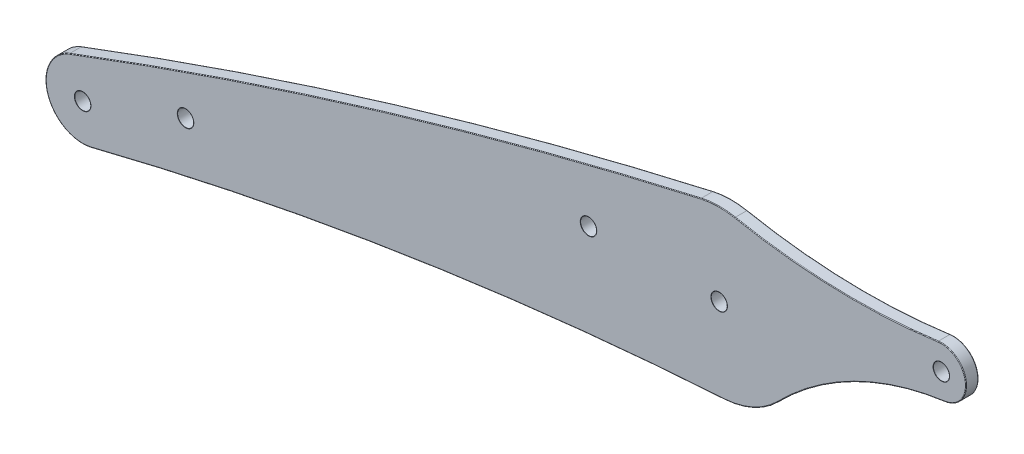
from build123d import *

# Parameters (mm, degrees)
BOSS_EXTRUDE1_DEPTH              = 3
M3_5_CLEARANCE_HOLE1_D           = 3.9
M3_5_CLEARANCE_HOLE1_DEPTH       = 10
M3_5_CLEARANCE_HOLE1_CSINK_D     = 3.95
M3_5_CLEARANCE_HOLE1_CSINK_ANGLE = 90
M3_5_CLEARANCE_HOLE1_TIP         = 1.171678207
FILLET1_R                        = 0.15


with BuildPart() as part:
    # Sketch1 → Boss-Extrude1 (new body)
    with BuildSketch(Plane.XY):
        with BuildLine():
            ThreePointArc((-224.015272003, 171.533169094), (-148.098758742, 197.332237707), (-70.569094062, 217.778753835))
            ThreePointArc((-70.569094062, 217.778753835), (-66.438171207, 218.27179356), (-62.294616847, 217.899544886))
            ThreePointArc((-62.294616847, 217.899544886), (-37.687608562, 215.152778571), (-12.963979761, 216.491345274))
            ThreePointArc((-12.963979761, 216.491345274), (-6.2015881, 211.360407363), (-11.337827727, 204.602041635))
            ThreePointArc((-11.337827727, 204.602041635), (-33.296637982, 197.807484116), (-51.870705986, 184.266459136))
            ThreePointArc((-51.870705986, 184.266459136), (-57.830628756, 180.084625725), (-64.892545086, 178.313256803))
            ThreePointArc((-64.892545086, 178.313256803), (-142.310888673, 169.876188253), (-218.632111132, 154.388933759))
            ThreePointArc((-218.632111132, 154.388933759), (-229.410768693, 160.421770071), (-224.015272003, 171.533169094))
        make_face()
    extrude(amount=-BOSS_EXTRUDE1_DEPTH)

    # M3.5 Clearance Hole1
    with Locations(Plane.XY):
        with Locations((-220.824105329, 163.117917746), (-195.824105329, 172.033120757), (-97.896241747, 198.246037312), (-66.146241747, 198.273924243), (-12.146241747, 210.547331096)):
            CounterSinkHole(M3_5_CLEARANCE_HOLE1_D / 2, M3_5_CLEARANCE_HOLE1_CSINK_D / 2, depth=M3_5_CLEARANCE_HOLE1_DEPTH, counter_sink_angle=M3_5_CLEARANCE_HOLE1_CSINK_ANGLE)
            with Locations((0, 0, -(M3_5_CLEARANCE_HOLE1_DEPTH + M3_5_CLEARANCE_HOLE1_TIP / 2))):  # 118° drill point
                Cone(0, M3_5_CLEARANCE_HOLE1_D / 2, M3_5_CLEARANCE_HOLE1_TIP, mode=Mode.SUBTRACT)

    # Fillet1
    # the kernel refuses this fillet: 0.15 mm, written as the material it takes off along each edge
    with BuildSketch(Plane(origin=(-1.906330822, 135.24033126, 0), x_dir=(-0.1347356700689116, 0.9908815767845728, 0), z_dir=(0.9908815767845728, 0.1347356700689116, 0))) as fillet1_piece_1:
        with BuildLine():
            CenterArc((70 + FILLET1_R, -FILLET1_R), FILLET1_R, 90, 90)
            Line((70 + FILLET1_R, 0), (70 + FILLET1_R, FILLET1_R * 0.02))
            Line((70 + FILLET1_R, FILLET1_R * 0.02), (70 - FILLET1_R * 0.0200000000001, FILLET1_R * 0.02))
            Line((70 - FILLET1_R * 0.0200000000001, FILLET1_R * 0.02), (70 - FILLET1_R * 0.0200000000001, -FILLET1_R))
            Line((70 - FILLET1_R * 0.0200000000001, -FILLET1_R), (70, -FILLET1_R))
        make_face()
    revolve(axis=Axis((-1.906330822, 135.24033126, 0), (0, 0, 1)), revolution_arc=37.799706741, mode=Mode.SUBTRACT)
    with BuildSketch(Plane(origin=(-66.146241747, 198.273924243, 0), x_dir=(0.7137767880581837, -0.7003732553641258, 0), z_dir=(0.7003732553641258, 0.7137767880581837, 0))) as fillet1_piece_2:
        with BuildLine():
            CenterArc((20 - FILLET1_R, FILLET1_R), FILLET1_R, 270, 90)
            Line((20 - FILLET1_R, 0), (20 - FILLET1_R, -FILLET1_R * 0.02))
            Line((20 - FILLET1_R, -FILLET1_R * 0.02), (20 + FILLET1_R * 0.02, -FILLET1_R * 0.02))
            Line((20 + FILLET1_R * 0.02, -FILLET1_R * 0.02), (20 + FILLET1_R * 0.0199999999999, FILLET1_R))
            Line((20 + FILLET1_R * 0.0199999999999, FILLET1_R), (20, FILLET1_R))
        make_face()
    revolve(axis=Axis((-66.146241747, 198.273924243, 0), (0, 0, -1)), revolution_arc=41.949109333, mode=Mode.SUBTRACT)
    with BuildSketch(Plane(origin=(-11.610436968, -670.01510943, 0), x_dir=(-0.0626848330802095, 0.9980333720380827, 0), z_dir=(0.9980333720380827, 0.0626848330802095, 0))) as fillet1_piece_3:
        with BuildLine():
            CenterArc((850 + FILLET1_R, -FILLET1_R), FILLET1_R, 90, 90)
            Line((850, -FILLET1_R), (850 - FILLET1_R * 0.0200000000003, -FILLET1_R))
            Line((850 - FILLET1_R * 0.0200000000003, -FILLET1_R), (850 - FILLET1_R * 0.0200000000003, FILLET1_R * 0.02))
            Line((850 - FILLET1_R * 0.0200000000003, FILLET1_R * 0.02), (850 + FILLET1_R, FILLET1_R * 0.02))
            Line((850 + FILLET1_R, FILLET1_R * 0.02), (850 + FILLET1_R, 0))
        make_face()
    revolve(axis=Axis((-11.610436968, -670.01510943, 0), (0, 0, 1)), revolution_arc=10.502516864, mode=Mode.SUBTRACT)
    with BuildSketch(Plane(origin=(-220.824105329, 163.117917746, 0), x_dir=(0.24355491078225822, -0.9698871096338203, 0), z_dir=(0.9698871096338203, 0.24355491078225822, 0))) as fillet1_piece_4:
        with BuildLine():
            CenterArc((9 - FILLET1_R, FILLET1_R), FILLET1_R, 270, 90)
            Line((9 - FILLET1_R, 0), (9 - FILLET1_R, -FILLET1_R * 0.02))
            Line((9 - FILLET1_R, -FILLET1_R * 0.02), (9 + FILLET1_R * 0.0200000000001, -FILLET1_R * 0.02))
            Line((9 + FILLET1_R * 0.0200000000001, -FILLET1_R * 0.02), (9 + FILLET1_R * 0.0200000000001, FILLET1_R))
            Line((9 + FILLET1_R * 0.0200000000001, FILLET1_R), (9, FILLET1_R))
        make_face()
    revolve(axis=Axis((-220.824105329, 163.117917746, 0), (0, 0, -1)), revolution_arc=173.329106849, mode=Mode.SUBTRACT)
    with BuildSketch(Plane(origin=(-66.146241747, 198.273924243, -3), x_dir=(0.7137767880581837, -0.7003732553641258, 0), z_dir=(0.7003732553641258, 0.7137767880581837, 0))) as fillet1_piece_5:
        with BuildLine():
            CenterArc((20 - FILLET1_R, -FILLET1_R), FILLET1_R, 0, 90)
            Line((20, -FILLET1_R), (20 + FILLET1_R * 0.0199999999999, -FILLET1_R))
            Line((20 + FILLET1_R * 0.0199999999999, -FILLET1_R), (20 + FILLET1_R * 0.02, FILLET1_R * 0.02))
            Line((20 + FILLET1_R * 0.02, FILLET1_R * 0.02), (20 - FILLET1_R, FILLET1_R * 0.02))
            Line((20 - FILLET1_R, FILLET1_R * 0.02), (20 - FILLET1_R, 0))
        make_face()
    revolve(axis=Axis((-66.146241747, 198.273924243, -3), (0, 0, -1)), revolution_arc=41.949109333, mode=Mode.SUBTRACT)
    with BuildSketch(Plane(origin=(-1.906330822, 135.24033126, -3), x_dir=(-0.1347356700689116, 0.9908815767845728, 0), z_dir=(0.9908815767845728, 0.1347356700689116, 0))) as fillet1_piece_6:
        with BuildLine():
            CenterArc((70 + FILLET1_R, FILLET1_R), FILLET1_R, 180, 90)
            Line((70, FILLET1_R), (70 - FILLET1_R * 0.0200000000001, FILLET1_R))
            Line((70 - FILLET1_R * 0.0200000000001, FILLET1_R), (70 - FILLET1_R * 0.0200000000001, -FILLET1_R * 0.02))
            Line((70 - FILLET1_R * 0.0200000000001, -FILLET1_R * 0.02), (70 + FILLET1_R, -FILLET1_R * 0.02))
            Line((70 + FILLET1_R, -FILLET1_R * 0.02), (70 + FILLET1_R, 0))
        make_face()
    revolve(axis=Axis((-1.906330822, 135.24033126, -3), (0, 0, 1)), revolution_arc=37.799706741, mode=Mode.SUBTRACT)
    with BuildSketch(Plane(origin=(-12.146241747, 210.547331096, -3), x_dir=(-0.1362896688862403, 0.9906690295728836, 0), z_dir=(-0.9906690295728836, -0.1362896688862403, 0))) as fillet1_piece_7:
        with BuildLine():
            CenterArc((6 - FILLET1_R, -FILLET1_R), FILLET1_R, 0, 90)
            Line((6, -FILLET1_R), (6 + FILLET1_R * 0.02, -FILLET1_R))
            Line((6 + FILLET1_R * 0.02, -FILLET1_R), (6 + FILLET1_R * 0.02, FILLET1_R * 0.02))
            Line((6 + FILLET1_R * 0.02, FILLET1_R * 0.02), (6 - FILLET1_R, FILLET1_R * 0.02))
            Line((6 - FILLET1_R, FILLET1_R * 0.02), (6 - FILLET1_R, 0))
        make_face()
    revolve(axis=Axis((-12.146241747, 210.547331096, -3), (0, 0, -1)), revolution_arc=180.089866547, mode=Mode.SUBTRACT)
    with BuildSketch(Plane(origin=(-33.407430094, 365.091699709, -3), x_dir=(-0.19258124502204366, -0.9812810321542751, 0), z_dir=(-0.9812810321542751, 0.19258124502204366, 0))) as fillet1_piece_8:
        with BuildLine():
            CenterArc((150 + FILLET1_R, FILLET1_R), FILLET1_R, 180, 90)
            Line((150, FILLET1_R), (150 - FILLET1_R * 0.0199999999999, FILLET1_R))
            Line((150 - FILLET1_R * 0.0199999999999, FILLET1_R), (150 - FILLET1_R * 0.0199999999999, -FILLET1_R * 0.02))
            Line((150 - FILLET1_R * 0.0199999999999, -FILLET1_R * 0.02), (150 + FILLET1_R, -FILLET1_R * 0.02))
            Line((150 + FILLET1_R, -FILLET1_R * 0.02), (150 + FILLET1_R, 0))
        make_face()
    revolve(axis=Axis((-33.407430094, 365.091699709, -3), (0, 0, 1)), revolution_arc=18.936662977, mode=Mode.SUBTRACT)
    with BuildSketch(Plane(origin=(-66.146241747, 198.273924243, -3), x_dir=(-0.22114261575913643, 0.9752414795809328, 0), z_dir=(-0.9752414795809328, -0.22114261575913643, 0))) as fillet1_piece_9:
        with BuildLine():
            CenterArc((20 - FILLET1_R, -FILLET1_R), FILLET1_R, 0, 90)
            Line((20, -FILLET1_R), (20 + FILLET1_R * 0.02, -FILLET1_R))
            Line((20 + FILLET1_R * 0.02, -FILLET1_R), (20 + FILLET1_R * 0.02, FILLET1_R * 0.02))
            Line((20 + FILLET1_R * 0.02, FILLET1_R * 0.02), (20 - FILLET1_R, FILLET1_R * 0.02))
            Line((20 - FILLET1_R, FILLET1_R * 0.02), (20 - FILLET1_R, 0))
        make_face()
    revolve(axis=Axis((-66.146241747, 198.273924243, -3), (0, 0, -1)), revolution_arc=23.879614349, mode=Mode.SUBTRACT)
    with BuildSketch(Plane(origin=(-12.146241747, 210.547331096, -3), x_dir=(-1, 0, 0), z_dir=(0, -1, 0))) as fillet1_piece_10:
        with BuildLine():
            CenterArc((1.95 + FILLET1_R, -FILLET1_R), FILLET1_R, 90, 90)
            Line((1.95, -FILLET1_R), (1.95 - FILLET1_R * 0.02, -FILLET1_R))
            Line((1.95 - FILLET1_R * 0.02, -FILLET1_R), (1.95 - FILLET1_R * 0.02, FILLET1_R * 0.02))
            Line((1.95 - FILLET1_R * 0.02, FILLET1_R * 0.02), (1.95 + FILLET1_R, FILLET1_R * 0.02))
            Line((1.95 + FILLET1_R, FILLET1_R * 0.02), (1.95 + FILLET1_R, 0))
        make_face()
    revolve(axis=Axis((-12.146241747, 210.547331096, -3), (0, 0, -1)), mode=Mode.SUBTRACT)
    with BuildSketch(Plane(origin=(-12.146241747, 210.547331096, 0), x_dir=(-1, 0, 0), z_dir=(0, -1, 0))) as fillet1_piece_11:
        with BuildLine():
            CenterArc((2.03291562, 0.15), FILLET1_R, 236.442690238, 33.557309762)
            Line((2.03291562, 0), (2.03291562, -0.003))
            Line((2.03291562, -0.003), (1.975, -0.003))
            Line((1.975, -0.003), (1.97287868, -0.00212132))
            ThreePointArc((1.97287868, -0.00212132), (1.96037868, 0.01037868), (1.948341688, 0.0225))
            Line((1.948341688, 0.0225), (1.95, 0.025))
        make_face()
    revolve(axis=Axis((-12.146241747, 210.547331096, 0), (0, 0, -1)), mode=Mode.SUBTRACT)
    with BuildSketch(Plane(origin=(183.744914061, -903.748947683, -3), x_dir=(-0.3545740748378603, 0.935027927632579, 0), z_dir=(-0.935027927632579, -0.3545740748378603, 0))) as fillet1_piece_12:
        with BuildLine():
            CenterArc((1150 - FILLET1_R, -FILLET1_R), FILLET1_R, 0, 90)
            Line((1150, -FILLET1_R), (1150 + FILLET1_R * 0.020000000001, -FILLET1_R))
            Line((1150 + FILLET1_R * 0.020000000001, -FILLET1_R), (1150 + FILLET1_R * 0.020000000001, FILLET1_R * 0.02))
            Line((1150 + FILLET1_R * 0.020000000001, FILLET1_R * 0.02), (1150 - FILLET1_R, FILLET1_R * 0.02))
            Line((1150 - FILLET1_R, FILLET1_R * 0.02), (1150 - FILLET1_R, 0))
        make_face()
    revolve(axis=Axis((183.744914061, -903.748947683, -3), (0, 0, -1)), revolution_arc=7.991189503, mode=Mode.SUBTRACT)
    with BuildSketch(Plane(origin=(-66.146241747, 198.273924243, -3), x_dir=(-1, 0, 0), z_dir=(0, -1, 0))) as fillet1_piece_13:
        with BuildLine():
            CenterArc((1.95 + FILLET1_R, -FILLET1_R), FILLET1_R, 90, 90)
            Line((1.95, -FILLET1_R), (1.95 - FILLET1_R * 0.02, -FILLET1_R))
            Line((1.95 - FILLET1_R * 0.02, -FILLET1_R), (1.95 - FILLET1_R * 0.02, FILLET1_R * 0.02))
            Line((1.95 - FILLET1_R * 0.02, FILLET1_R * 0.02), (1.95 + FILLET1_R, FILLET1_R * 0.02))
            Line((1.95 + FILLET1_R, FILLET1_R * 0.02), (1.95 + FILLET1_R, 0))
        make_face()
    revolve(axis=Axis((-66.146241747, 198.273924243, -3), (0, 0, -1)), mode=Mode.SUBTRACT)
    with BuildSketch(Plane(origin=(-66.146241747, 198.273924243, 0), x_dir=(-1, 0, 0), z_dir=(0, -1, 0))) as fillet1_piece_14:
        with BuildLine():
            CenterArc((2.03291562, 0.15), FILLET1_R, 236.442690238, 33.557309762)
            Line((2.03291562, 0), (2.03291562, -0.003))
            Line((2.03291562, -0.003), (1.975, -0.003))
            Line((1.975, -0.003), (1.97287868, -0.00212132))
            ThreePointArc((1.97287868, -0.00212132), (1.96037868, 0.01037868), (1.948341688, 0.0225))
            Line((1.948341688, 0.0225), (1.95, 0.025))
        make_face()
    revolve(axis=Axis((-66.146241747, 198.273924243, 0), (0, 0, -1)), mode=Mode.SUBTRACT)
    with BuildSketch(Plane(origin=(-97.896241747, 198.246037312, -3), x_dir=(-1, 0, 0), z_dir=(0, -1, 0))) as fillet1_piece_15:
        with BuildLine():
            CenterArc((1.95 + FILLET1_R, -FILLET1_R), FILLET1_R, 90, 90)
            Line((1.95, -FILLET1_R), (1.95 - FILLET1_R * 0.02, -FILLET1_R))
            Line((1.95 - FILLET1_R * 0.02, -FILLET1_R), (1.95 - FILLET1_R * 0.02, FILLET1_R * 0.02))
            Line((1.95 - FILLET1_R * 0.02, FILLET1_R * 0.02), (1.95 + FILLET1_R, FILLET1_R * 0.02))
            Line((1.95 + FILLET1_R, FILLET1_R * 0.02), (1.95 + FILLET1_R, 0))
        make_face()
    revolve(axis=Axis((-97.896241747, 198.246037312, -3), (0, 0, -1)), mode=Mode.SUBTRACT)
    with BuildSketch(Plane(origin=(-97.896241747, 198.246037312, 0), x_dir=(-1, 0, 0), z_dir=(0, -1, 0))) as fillet1_piece_16:
        with BuildLine():
            CenterArc((2.03291562, 0.15), FILLET1_R, 236.442690238, 33.557309762)
            Line((2.03291562, 0), (2.03291562, -0.003))
            Line((2.03291562, -0.003), (1.975, -0.003))
            Line((1.975, -0.003), (1.97287868, -0.00212132))
            ThreePointArc((1.97287868, -0.00212132), (1.96037868, 0.01037868), (1.948341688, 0.0225))
            Line((1.948341688, 0.0225), (1.95, 0.025))
        make_face()
    revolve(axis=Axis((-97.896241747, 198.246037312, 0), (0, 0, -1)), mode=Mode.SUBTRACT)
    with BuildSketch(Plane(origin=(-220.824105329, 163.117917746, -3), x_dir=(0.24355491078225822, -0.9698871096338203, 0), z_dir=(0.9698871096338203, 0.24355491078225822, 0))) as fillet1_piece_17:
        with BuildLine():
            CenterArc((9 - FILLET1_R, -FILLET1_R), FILLET1_R, 0, 90)
            Line((9 - FILLET1_R, 0), (9 - FILLET1_R, FILLET1_R * 0.02))
            Line((9 - FILLET1_R, FILLET1_R * 0.02), (9 + FILLET1_R * 0.0200000000001, FILLET1_R * 0.02))
            Line((9 + FILLET1_R * 0.0200000000001, FILLET1_R * 0.02), (9 + FILLET1_R * 0.0200000000001, -FILLET1_R))
            Line((9 + FILLET1_R * 0.0200000000001, -FILLET1_R), (9, -FILLET1_R))
        make_face()
    revolve(axis=Axis((-220.824105329, 163.117917746, -3), (0, 0, -1)), revolution_arc=173.329106849, mode=Mode.SUBTRACT)
    with BuildSketch(Plane(origin=(-195.824105329, 172.033120757, -3), x_dir=(-1, 0, 0), z_dir=(0, -1, 0))) as fillet1_piece_18:
        with BuildLine():
            CenterArc((1.95 + FILLET1_R, -FILLET1_R), FILLET1_R, 90, 90)
            Line((1.95, -FILLET1_R), (1.95 - FILLET1_R * 0.0199999999999, -FILLET1_R))
            Line((1.95 - FILLET1_R * 0.0199999999999, -FILLET1_R), (1.95 - FILLET1_R * 0.0199999999999, FILLET1_R * 0.02))
            Line((1.95 - FILLET1_R * 0.0199999999999, FILLET1_R * 0.02), (1.95 + FILLET1_R, FILLET1_R * 0.02))
            Line((1.95 + FILLET1_R, FILLET1_R * 0.02), (1.95 + FILLET1_R, 0))
        make_face()
    revolve(axis=Axis((-195.824105329, 172.033120757, -3), (0, 0, -1)), mode=Mode.SUBTRACT)
    with BuildSketch(Plane(origin=(-195.824105329, 172.033120757, 0), x_dir=(-1, 0, 0), z_dir=(0, -1, 0))) as fillet1_piece_19:
        with BuildLine():
            CenterArc((2.03291562, 0.15), FILLET1_R, 236.442690238, 33.557309762)
            Line((2.03291562, 0), (2.03291562, -0.003))
            Line((2.03291562, -0.003), (1.975, -0.003))
            Line((1.975, -0.003), (1.97287868, -0.00212132))
            ThreePointArc((1.97287868, -0.00212132), (1.96037868, 0.01037868), (1.948341688, 0.0225))
            Line((1.948341688, 0.0225), (1.95, 0.025))
        make_face()
    revolve(axis=Axis((-195.824105329, 172.033120757, 0), (0, 0, -1)), mode=Mode.SUBTRACT)
    with BuildSketch(Plane(origin=(-220.824105329, 163.117917746, -3), x_dir=(-1, 0, 0), z_dir=(0, -1, 0))) as fillet1_piece_20:
        with BuildLine():
            CenterArc((1.95 + FILLET1_R, -FILLET1_R), FILLET1_R, 90, 90)
            Line((1.95, -FILLET1_R), (1.95 - FILLET1_R * 0.0199999999999, -FILLET1_R))
            Line((1.95 - FILLET1_R * 0.0199999999999, -FILLET1_R), (1.95 - FILLET1_R * 0.0199999999999, FILLET1_R * 0.02))
            Line((1.95 - FILLET1_R * 0.0199999999999, FILLET1_R * 0.02), (1.95 + FILLET1_R, FILLET1_R * 0.02))
            Line((1.95 + FILLET1_R, FILLET1_R * 0.02), (1.95 + FILLET1_R, 0))
        make_face()
    revolve(axis=Axis((-220.824105329, 163.117917746, -3), (0, 0, -1)), mode=Mode.SUBTRACT)
    with BuildSketch(Plane(origin=(-220.824105329, 163.117917746, 0), x_dir=(-1, 0, 0), z_dir=(0, -1, 0))) as fillet1_piece_21:
        with BuildLine():
            CenterArc((2.03291562, 0.15), FILLET1_R, 236.442690238, 33.557309762)
            Line((2.03291562, 0), (2.03291562, -0.003))
            Line((2.03291562, -0.003), (1.975, -0.003))
            Line((1.975, -0.003), (1.97287868, -0.00212132))
            ThreePointArc((1.97287868, -0.00212132), (1.96037868, 0.01037868), (1.948341688, 0.0225))
            Line((1.948341688, 0.0225), (1.95, 0.025))
        make_face()
    revolve(axis=Axis((-220.824105329, 163.117917746, 0), (0, 0, -1)), mode=Mode.SUBTRACT)
    with BuildSketch(Plane(origin=(183.744914061, -903.748947683, 0), x_dir=(-0.3545740748378603, 0.935027927632579, 0), z_dir=(-0.935027927632579, -0.3545740748378603, 0))) as fillet1_piece_22:
        with BuildLine():
            CenterArc((1150 - FILLET1_R, FILLET1_R), FILLET1_R, 270, 90)
            Line((1150, FILLET1_R), (1150 + FILLET1_R * 0.020000000001, FILLET1_R))
            Line((1150 + FILLET1_R * 0.020000000001, FILLET1_R), (1150 + FILLET1_R * 0.020000000001, -FILLET1_R * 0.02))
            Line((1150 + FILLET1_R * 0.020000000001, -FILLET1_R * 0.02), (1150 - FILLET1_R, -FILLET1_R * 0.02))
            Line((1150 - FILLET1_R, -FILLET1_R * 0.02), (1150 - FILLET1_R, 0))
        make_face()
    revolve(axis=Axis((183.744914061, -903.748947683, 0), (0, 0, -1)), revolution_arc=7.991189503, mode=Mode.SUBTRACT)
    with BuildSketch(Plane(origin=(-11.610436968, -670.01510943, -3), x_dir=(-0.0626848330802095, 0.9980333720380827, 0), z_dir=(0.9980333720380827, 0.0626848330802095, 0))) as fillet1_piece_23:
        with BuildLine():
            CenterArc((850 + FILLET1_R, FILLET1_R), FILLET1_R, 180, 90)
            Line((850, FILLET1_R), (850 - FILLET1_R * 0.0200000000003, FILLET1_R))
            Line((850 - FILLET1_R * 0.0200000000003, FILLET1_R), (850 - FILLET1_R * 0.0200000000003, -FILLET1_R * 0.02))
            Line((850 - FILLET1_R * 0.0200000000003, -FILLET1_R * 0.02), (850 + FILLET1_R, -FILLET1_R * 0.02))
            Line((850 + FILLET1_R, -FILLET1_R * 0.02), (850 + FILLET1_R, 0))
        make_face()
    revolve(axis=Axis((-11.610436968, -670.01510943, -3), (0, 0, 1)), revolution_arc=10.502516864, mode=Mode.SUBTRACT)
    with BuildSketch(Plane(origin=(-66.146241747, 198.273924243, 0), x_dir=(-0.22114261575913643, 0.9752414795809328, 0), z_dir=(-0.9752414795809328, -0.22114261575913643, 0))) as fillet1_piece_24:
        with BuildLine():
            CenterArc((20 - FILLET1_R, FILLET1_R), FILLET1_R, 270, 90)
            Line((20 - FILLET1_R, 0), (20 - FILLET1_R, -FILLET1_R * 0.02))
            Line((20 - FILLET1_R, -FILLET1_R * 0.02), (20 + FILLET1_R * 0.02, -FILLET1_R * 0.02))
            Line((20 + FILLET1_R * 0.02, -FILLET1_R * 0.02), (20 + FILLET1_R * 0.02, FILLET1_R))
            Line((20 + FILLET1_R * 0.02, FILLET1_R), (20, FILLET1_R))
        make_face()
    revolve(axis=Axis((-66.146241747, 198.273924243, 0), (0, 0, -1)), revolution_arc=23.879614349, mode=Mode.SUBTRACT)
    with BuildSketch(Plane(origin=(-33.407430094, 365.091699709, 0), x_dir=(-0.19258124502204366, -0.9812810321542751, 0), z_dir=(-0.9812810321542751, 0.19258124502204366, 0))) as fillet1_piece_25:
        with BuildLine():
            CenterArc((150 + FILLET1_R, -FILLET1_R), FILLET1_R, 90, 90)
            Line((150 + FILLET1_R, 0), (150 + FILLET1_R, FILLET1_R * 0.02))
            Line((150 + FILLET1_R, FILLET1_R * 0.02), (150 - FILLET1_R * 0.0199999999999, FILLET1_R * 0.02))
            Line((150 - FILLET1_R * 0.0199999999999, FILLET1_R * 0.02), (150 - FILLET1_R * 0.0199999999999, -FILLET1_R))
            Line((150 - FILLET1_R * 0.0199999999999, -FILLET1_R), (150, -FILLET1_R))
        make_face()
    revolve(axis=Axis((-33.407430094, 365.091699709, 0), (0, 0, 1)), revolution_arc=18.936662977, mode=Mode.SUBTRACT)
    with BuildSketch(Plane(origin=(-12.146241747, 210.547331096, 0), x_dir=(-0.1362896688862403, 0.9906690295728836, 0), z_dir=(-0.9906690295728836, -0.1362896688862403, 0))) as fillet1_piece_26:
        with BuildLine():
            CenterArc((6 - FILLET1_R, FILLET1_R), FILLET1_R, 270, 90)
            Line((6 - FILLET1_R, 0), (6 - FILLET1_R, -FILLET1_R * 0.02))
            Line((6 - FILLET1_R, -FILLET1_R * 0.02), (6 + FILLET1_R * 0.02, -FILLET1_R * 0.02))
            Line((6 + FILLET1_R * 0.02, -FILLET1_R * 0.02), (6 + FILLET1_R * 0.02, FILLET1_R))
            Line((6 + FILLET1_R * 0.02, FILLET1_R), (6, FILLET1_R))
        make_face()
    revolve(axis=Axis((-12.146241747, 210.547331096, 0), (0, 0, -1)), revolution_arc=180.089866547, mode=Mode.SUBTRACT)


solid = part.part
